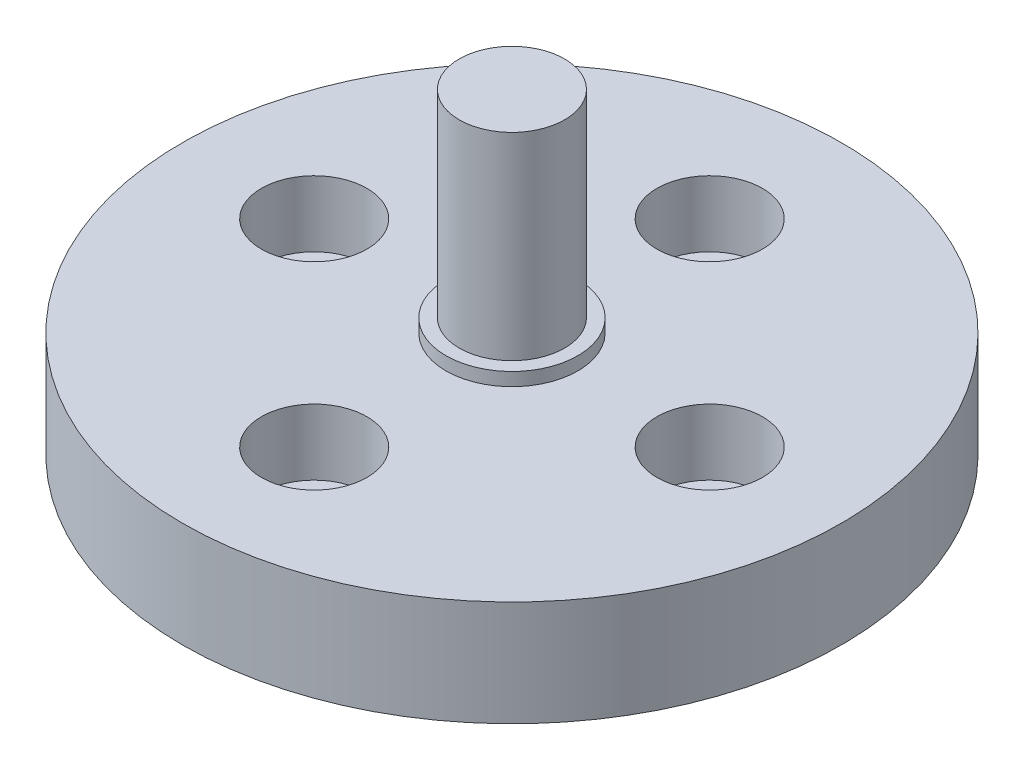
from build123d import *

# Parameters (mm, degrees)
SKETCH1_R           = 25
BOSS_EXTRUDE1_DEPTH = 8
SKETCH2_R           = 5
BOSS_EXTRUDE2_DEPTH = 1
SKETCH3_R           = 4
BOSS_EXTRUDE3_DEPTH = 15
HOLE1_D             = 4
HOLE1_CBORE_D       = 8
HOLE1_CBORE_DEPTH   = 5


with BuildPart() as part:
    # Sketch1 → Boss-Extrude1 (new body)
    with BuildSketch(Plane(origin=(0, 0, 0), x_dir=(1, 0, 0), z_dir=(0, 1, 0))):
        Circle(SKETCH1_R)
    extrude(amount=BOSS_EXTRUDE1_DEPTH)

    # Sketch2 → Boss-Extrude2 (add)
    with BuildSketch(Plane(origin=(0, 8, 0), x_dir=(1, 0, 0), z_dir=(0, 1, 0))):
        Circle(SKETCH2_R)
    extrude(amount=BOSS_EXTRUDE2_DEPTH)

    # Sketch3 → Boss-Extrude3 (add)
    with BuildSketch(Plane(origin=(0, 9, 0), x_dir=(1, 0, 0), z_dir=(0, 1, 0))):
        Circle(SKETCH3_R)
    extrude(amount=BOSS_EXTRUDE3_DEPTH)

    # Hole1 (through all)
    with Locations(Plane(origin=(0, 8, 0), x_dir=(1, 0, 0), z_dir=(0, 1, 0))):
        with Locations((-15, 0), (0, 15), (15, 0), (0, -15)):
            CounterBoreHole(HOLE1_D / 2, HOLE1_CBORE_D / 2, HOLE1_CBORE_DEPTH)


solid = part.part
